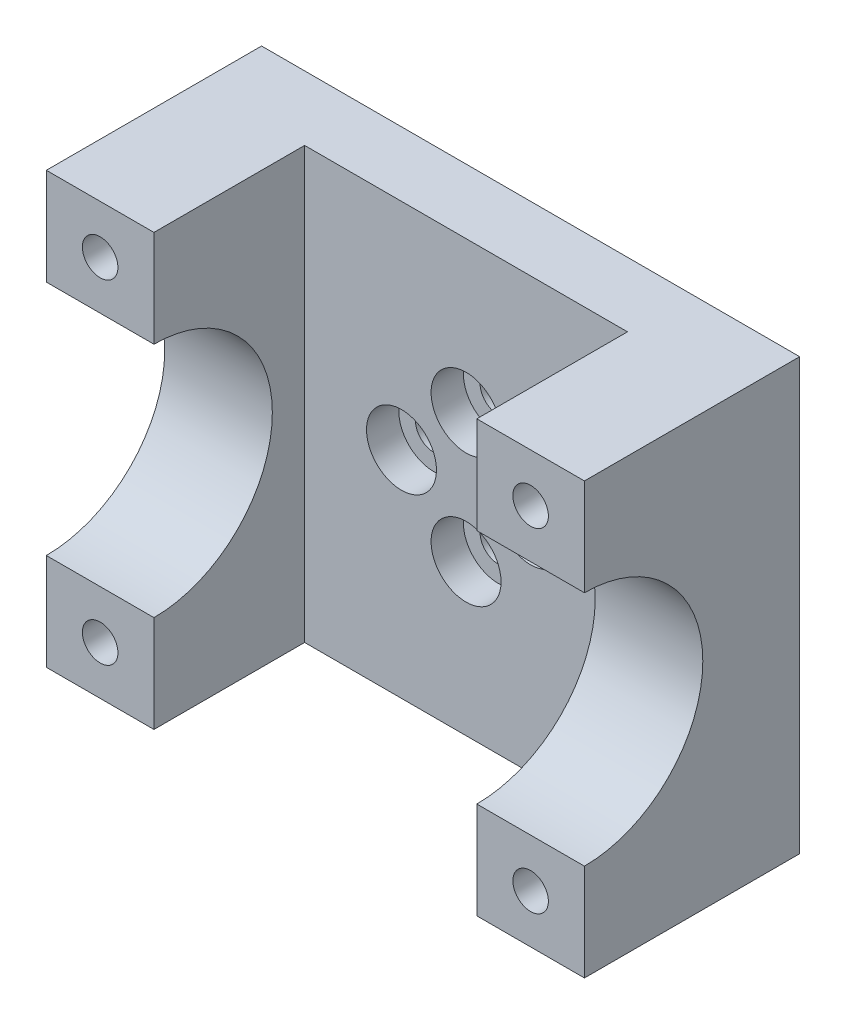
from build123d import *

# Parameters (mm, degrees)
SKETCH_1_W                  = 50
SKETCH_1_H                  = 40
EXTRUDE_1_DEPTH             = 20
CUT_EXTRUDE_1_DEPTH         = 68.082039325
SKETCH_3_W                  = 30
SKETCH_3_H                  = 40
CUT_EXTRUDE_2_DEPTH         = 14
HOLE_WIZARD_M31_D           = 3.4
HOLE_WIZARD_M31_CBORE_D     = 6.5
HOLE_WIZARD_M31_CBORE_DEPTH = 3
M4X0_71_D                   = 3.3


with BuildPart() as part:
    # Эскиз1 → Бобышка-Вытянуть1 (new body)
    with BuildSketch(Plane.XY):
        with Locations((25, 20)):
            Rectangle(SKETCH_1_W, SKETCH_1_H)
    extrude(amount=EXTRUDE_1_DEPTH)

    # Эскиз2 → Вырез-Вытянуть1 (cut, through all)
    with BuildSketch(Plane.ZY):
        with BuildLine():
            Line((20, 31), (20, 9))
            ThreePointArc((20, 9), (9, 20), (20, 31))
        make_face()
    extrude(amount=-CUT_EXTRUDE_1_DEPTH, mode=Mode.SUBTRACT)

    # Эскиз3 → Вырез-Вытянуть2 (cut)
    with BuildSketch(Plane.XY.offset(20)):
        with Locations((25, 20)):
            Rectangle(SKETCH_3_W, SKETCH_3_H)
    extrude(amount=-CUT_EXTRUDE_2_DEPTH, mode=Mode.SUBTRACT)

    # Цековка для винта с внутренним шестигранником M31 (through all)
    with Locations(Plane.XY.offset(6)):
        with Locations((25, 26), (19, 20), (25, 14), (31, 20)):
            CounterBoreHole(HOLE_WIZARD_M31_D / 2, HOLE_WIZARD_M31_CBORE_D / 2, HOLE_WIZARD_M31_CBORE_DEPTH)

    # Отверстие обработанное метчиком M4x0.71 (through all)
    with Locations(Plane.XY.offset(20)):
        with Locations((5, 35.5), (5, 4.5), (45, 4.5), (45, 35.5)):
            Hole(M4X0_71_D / 2)


solid = part.part
